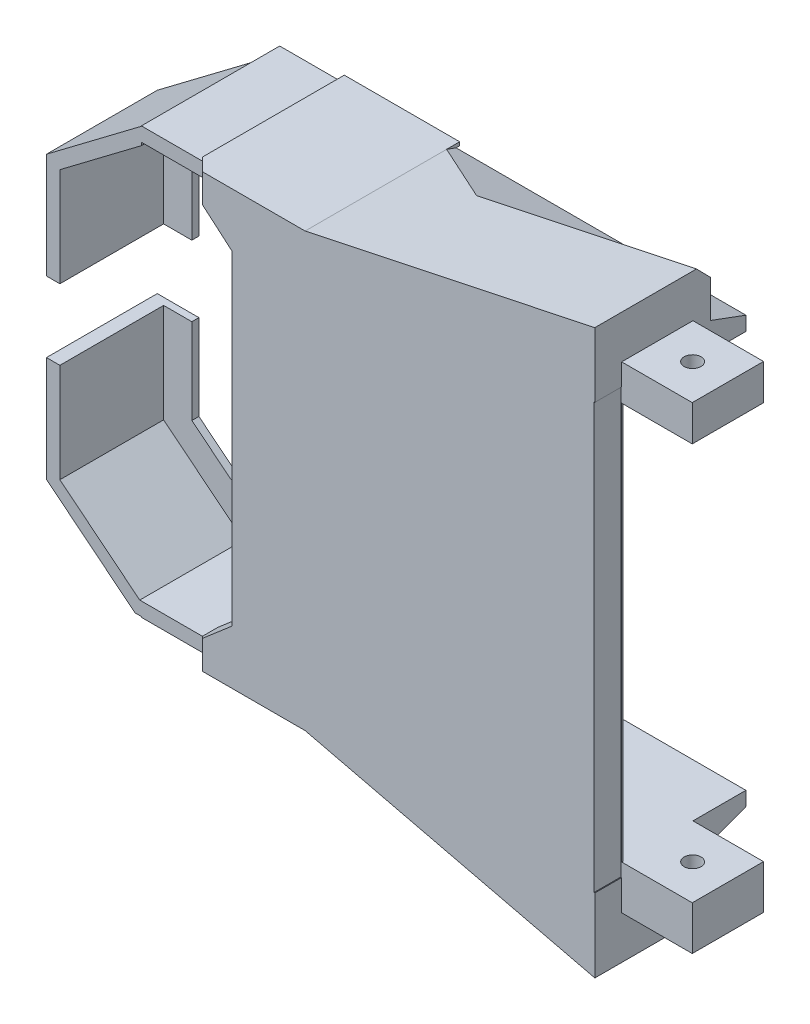
from build123d import *

# Parameters (mm, degrees)
SKETCH_2_W               = 25
SKETCH_2_H               = 2
EXTRUDE_1_DEPTH          = 15
EXTRUDE_1_2_DEPTH        = 15
EXTRUDE_2_DEPTH          = 2.6
EXTRUDE_3_DEPTH          = 15.7
EXTRUDE_4_DEPTH          = 1
EXTRUDE_5_DEPTH          = 2
SKETCH_7_W               = 2
SKETCH_7_H               = 56.3
EXTRUDE_6_DEPTH          = 3.9
SKETCH_8_W               = 4
SKETCH_8_H               = 4
SKETCH_8_R               = 1.2
EXTRUDE_7_DEPTH          = 2
EXTRUDE_START            = -16.35
EXTRUDE_8_DEPTH          = 16.35
CUT_EXTRUDE_1_DEPTH      = 2.6
EXTRUDE_9_DEPTH          = 41.05
SKETCH_12_W              = 10.1
SKETCH_12_H              = 3.07
EXTRUDE_10_DEPTH         = 10
CUT_EXTRUDE_2_DEPTH      = 135.796311397
CUT_EXTRUDE_2_DEPTH_BACK = 135.796311397
EXTRUDE_11_DEPTH         = 3.8
SKETCH_15_W              = 8.65
SKETCH_15_H              = 2
CUT_EXTRUDE_3_DEPTH      = 1.8
CUT_EXTRUDE_4_DEPTH      = 2.4
EXTRUDE_12_DEPTH         = 16.399999999
EXTRUDE_13_REACH         = 109.72
EXTRUDE_14_REACH         = 109.72
CHAMFER_1_SIZE           = 2
CHAMFER_3_SIZE           = 1.8
SKETCH_20_W              = 4
SKETCH_20_H              = 42.789151816
CUT_EXTRUDE_5_DEPTH      = 10
SKETCH_21_W              = 15.7
SKETCH_21_H              = 10
CUT_EXTRUDE_6_DEPTH      = 10


with BuildPart() as part:
    # 草图2 → 凸台-拉伸1 (new body)
    with BuildSketch(Plane.XY):
        with Locations((-91.85, 1)):
            Rectangle(SKETCH_2_W, SKETCH_2_H)
    extrude(amount=EXTRUDE_1_DEPTH)



with BuildPart() as body_2:
    # 草图2 → Extrude 1 2 (new body)
    with BuildSketch(Plane.XY):
        with Locations((-91.85, 59.3)):
            Rectangle(SKETCH_2_W, SKETCH_2_H)
    extrude(amount=EXTRUDE_1_2_DEPTH)


with BuildPart() as part_1:
    add(part.part)

    add(body_2.part)  # 凸台-拉伸2 merges body 2
    # 草图3 → 凸台-拉伸2 (add)
    with BuildSketch(Plane.XY.offset(15)):
        Polygon((-95.7, 2), (-104.35, 2), (-104.35, 0), (-79.35, 0), (-79.35, 60.3), (-104.35, 60.3), (-104.35, 58.3), (-95.7, 58.3), align=None)
    extrude(amount=EXTRUDE_2_DEPTH)

    # 草图4 → 凸台-拉伸3 (add)
    with BuildSketch(Plane.XY.offset(19.6)):
        Polygon((-104.35, 2), (-104.580416833, 2), (-115.895945033, 11.107600771), (-115.895945033, 49.153887402), (-104.35, 57.869625998), (-104.35, 58.3), (-104.35, 60.2), (-104.416493669, 60.2), (-117.795945033, 50.10019437), (-117.795945033, 10.197880039), (-105.250067231, 0.1), (-104.35, 0.1), align=None)
    extrude(amount=-EXTRUDE_3_DEPTH)

    # 草图5 → 凸台-拉伸4 (add)
    with BuildSketch(Plane(origin=(0, 0, 3.9), x_dir=(-1, 0, 0), z_dir=(0, 0, -1))):
        Polygon((104.35, 2), (104.35, 57.869625998), (115.895945033, 49.153887402), (115.895945033, 11.107600771), (104.580416833, 2), align=None)
    extrude(amount=-EXTRUDE_4_DEPTH)

    # 草图6 → 凸台-拉伸5 (add)
    with BuildSketch(Plane(origin=(-104.35, 0, 0), x_dir=(0, 0, -1), z_dir=(1, 0, 0))):
        Polygon((-4.9, 58.3), (-4.9, 57.869625998), (-4.9, 2), (-3.9, 2), (-3.9, 58.3), align=None)
    extrude(amount=EXTRUDE_5_DEPTH)

    # 草图7 → 凸台-拉伸6 (add)
    with BuildSketch(Plane(origin=(0, 0, 3.9), x_dir=(-1, 0, 0), z_dir=(0, 0, -1))):
        with Locations((103.35, 30.15)):
            Rectangle(SKETCH_7_W, SKETCH_7_H)
    extrude(amount=EXTRUDE_6_DEPTH)

    # 草图8 → 凸台-拉伸7 (add)
    # profile 1 of 2: a face of its own
    with BuildSketch(Plane(origin=(0, 0, 0), x_dir=(-1, 0, 0), z_dir=(0, 0, -1))):
        with Locations((100.35, 56.3)):
            Rectangle(SKETCH_8_W, SKETCH_8_H)
        with Locations((100.35, 56.3)):
            Circle(SKETCH_8_R, mode=Mode.SUBTRACT)
    # profile 2 of 2: a face of its own
    with BuildSketch(Plane(origin=(0, 0, 0), x_dir=(-1, 0, 0), z_dir=(0, 0, -1))):
        with Locations((100.35, 4)):
            Rectangle(SKETCH_8_W, SKETCH_8_H)
        with Locations((100.35, 4)):
            Circle(SKETCH_8_R, mode=Mode.SUBTRACT)
    extrude(amount=-EXTRUDE_7_DEPTH)

    # 草图9 → 凸台-拉伸8 (add)
    with BuildSketch(Plane(origin=(-79.35, 0, 0), x_dir=(0, 0, -1), z_dir=(1, 0, 0)).offset(EXTRUDE_START)):
        Polygon((-17.6, 0), (-17.6, -0.5), (0.5, -0.5), (0.5, 0), (0, 0), align=None)
        Polygon((-17.6, 60.8), (-17.6, 60.3), (0, 60.3), (0.5, 60.3), (0.5, 60.8), align=None)
    extrude(amount=EXTRUDE_8_DEPTH)

    # 草图10 → 切除-拉伸1 (cut)
    with BuildSketch(Plane.XY.offset(17.6)):
        Polygon((-95.7, 58.3), (-89.7, 53.15), (-89.7, 7.15), (-95.7, 2), align=None)
    extrude(amount=-CUT_EXTRUDE_1_DEPTH, mode=Mode.SUBTRACT)

    # 草图11 → 凸台-拉伸9 (add)
    with BuildSketch(Plane(origin=(-79.35, 0, 0), x_dir=(0, 0, -1), z_dir=(1, 0, 0))):
        Polygon((-17.6, 0.1), (0, 0), (0, 2), (-15, 2), (-15, 58.3), (0, 58.3), (0, 60.3), (-17.6, 60.3), align=None)
    extrude(amount=EXTRUDE_9_DEPTH)

    # 草图12 → 凸台-拉伸10 (add)
    with BuildSketch(Plane(origin=(-38.3, 0, 0), x_dir=(0, 0, -1), z_dir=(1, 0, 0))):
        Polygon((-7.5, 0.042613636), (-7.5, 2), (-15, 2), (-17.6, 2), (-17.6, 0.1), align=None)
        Polygon((-7.5, -4.23), (-7.5, 0.042613636), (-17.6, 0.1), (-17.6, -4.23), align=None)
        with Locations((-12.55, 61.835)):
            Rectangle(SKETCH_12_W, SKETCH_12_H)
        Polygon((-15, 58.3), (-7.5, 58.3), (-7.5, 60.3), (-17.6, 60.3), (-17.6, 58.3), align=None)
    extrude(amount=EXTRUDE_10_DEPTH)

    # 草图13 → 切除-拉伸2 (cut, two sides: drawn at the far end of the back side and taken through both)
    with BuildSketch(Plane.XZ.offset(-58.3).offset(-CUT_EXTRUDE_2_DEPTH_BACK)):
        with BuildLine():
            ThreePointArc((-32.1, 12.55), (-32.838023478, 13.657509681), (-34.144296155, 13.402739117))
            Line((-34.144296155, 13.402739117), (-32.455703844, 11.697260883))
            ThreePointArc((-32.455703844, 11.697260883), (-32.192490319, 12.088023478), (-32.1, 12.55))
        make_face()
        with BuildLine():
            Line((-32.455703844, 11.697260883), (-34.144296155, 13.402739117))
            ThreePointArc((-34.144296155, 13.402739117), (-34.152739117, 11.705703844), (-32.455703844, 11.697260883))
        make_face()
    extrude(amount=CUT_EXTRUDE_2_DEPTH + CUT_EXTRUDE_2_DEPTH_BACK, mode=Mode.SUBTRACT)

    # 草图14 → 凸台-拉伸11 (add)
    with BuildSketch(Plane.XY.offset(17.6)):
        Polygon((-79.35, 0.1), (-38.42, 0.1), (-38.42, 2), (-38.42, 58.3), (-38.42, 60.3), (-79.35, 60.3), (-79.35, 60.8), (-95.7, 60.8), (-95.7, 60.3), (-104.35, 60.3), (-104.35, 60.2), (-104.35, 58.3), (-95.7, 58.3), (-89.7, 53.15), (-89.7, 7.15), (-95.7, 2), (-104.35, 2), (-104.35, 0.1), (-104.35, 0), (-95.7, 0), (-95.7, -0.5), (-79.35, -0.5), align=None)
    extrude(amount=EXTRUDE_11_DEPTH)

    # 草图15 → 切除-拉伸3 (cut)
    with BuildSketch(Plane.XY.offset(21.4)):
        with Locations((-100.025, 59.3)):
            Rectangle(SKETCH_15_W, SKETCH_15_H)
        with Locations((-100.025, 1)):
            Rectangle(SKETCH_15_W, SKETCH_15_H)
    extrude(amount=-CUT_EXTRUDE_3_DEPTH, mode=Mode.SUBTRACT)

    # 草图16 → 切除-拉伸4 (cut)
    with BuildSketch(Plane(origin=(0, 0, 15), x_dir=(-1, 0, 0), z_dir=(0, 0, -1))):
        Polygon((89.7, 53.15), (95.7, 58.3), (38.3, 58.3), (38.3, 2), (95.7, 2), (89.7, 7.15), align=None)
    extrude(amount=-CUT_EXTRUDE_4_DEPTH, mode=Mode.SUBTRACT)

    # 草图17 → 凸台-拉伸12 (add)
    with BuildSketch(Plane.XY.offset(21.4)):
        Polygon((-38.42, 60.3), (-38.3, 60.3), (-38.3, 69.47), (-79.35, 60.8), (-79.35, 60.3), align=None)
        Polygon((-79.35, -0.5), (-38.3, -10.33), (-38.3, 0.1), (-38.42, 0.1), (-79.35, 0.1), align=None)
    extrude(amount=-EXTRUDE_12_DEPTH)

    # 凸台-拉伸13: up to this plane
    extrude_13_end = Plane(origin=(-15.681436973, 74.247172751, -37.354307927), z_dir=(0.20664708387422698, -0.9784155470587527, 0))
    # 草图18 → 凸台-拉伸13 (add, up to the surface)
    with BuildSketch(Plane(origin=(-38.3, 0, 0), x_dir=(0, 0, -1), z_dir=(1, 0, 0)), mode=Mode.PRIVATE) as extrude_13_sk1:
        Polygon((-5.000000001, 60.3), (0, 60.3), (-5, 62.15), align=None)
    extrude_13_tool1 = split(extrude(extrude_13_sk1.sketch, amount=-EXTRUDE_13_REACH, mode=Mode.PRIVATE), bisect_by=extrude_13_end, keep=Keep.BOTH, mode=Mode.PRIVATE)
    add(extrude_13_tool1.solids().sort_by_distance((-38.3, 60.916667, 3.333333))[0])

    # 凸台-拉伸14: up to this plane
    extrude_14_end = Plane(origin=(-4.416638762, -18.443847527, -37.354307927), z_dir=(-0.23288011181129656, -0.9725054516673715, 0))
    # 草图19 → 凸台-拉伸14 (add, up to the surface)
    with BuildSketch(Plane(origin=(-38.3, 0, 0), x_dir=(0, 0, -1), z_dir=(1, 0, 0)), mode=Mode.PRIVATE) as extrude_14_sk1:
        Polygon((-5, -1.85), (0, 0), (-5, 0.028409091), align=None)
    extrude_14_tool1 = split(extrude(extrude_14_sk1.sketch, amount=-EXTRUDE_14_REACH, mode=Mode.PRIVATE), bisect_by=extrude_14_end, keep=Keep.BOTH, mode=Mode.PRIVATE)
    add(extrude_14_tool1.solids().sort_by_distance((-38.3, -0.607197, 3.333333))[0])

    # 倒角1
    chamfer_1_edges = [part_1.edges().sort_by_distance(p)[0] for p in [
        (-55.629065744, 65.81, 5.000000001),
        (-56.006205493, -6.09, 5.000000001),
    ]]
    chamfer(chamfer_1_edges, length=CHAMFER_1_SIZE)

    # 倒角3
    chamfer_3_edges = [part_1.edges().sort_by_distance(p)[0] for p in [
        (-95.7, 59.55, 21.4),
        (-95.7, 0.75, 21.4),
    ]]
    chamfer(chamfer_3_edges, length=CHAMFER_3_SIZE - 0.0001)  # a hair under: the kernel refuses the full size

    # 草图20 → 切除-拉伸5 (cut)
    with BuildSketch(Plane.XY.offset(4.9)):
        Polygon((-106.35, 8.559002447), (-106.35, 51.348154263), (-111.895945033, 47.161662205), (-111.895945033, 13.022802313), align=None)
        with Locations((-104.35, 29.953578355)):
            Rectangle(SKETCH_20_W, SKETCH_20_H)
    extrude(amount=-CUT_EXTRUDE_5_DEPTH, mode=Mode.SUBTRACT)

    # 草图21 → 切除-拉伸6 (cut)
    with BuildSketch(Plane.ZY.offset(117.795945033)):
        with Locations((11.75, 30.149037204)):
            Rectangle(SKETCH_21_W, SKETCH_21_H)
    extrude(amount=-CUT_EXTRUDE_6_DEPTH, mode=Mode.SUBTRACT)


solid = part_1.part
